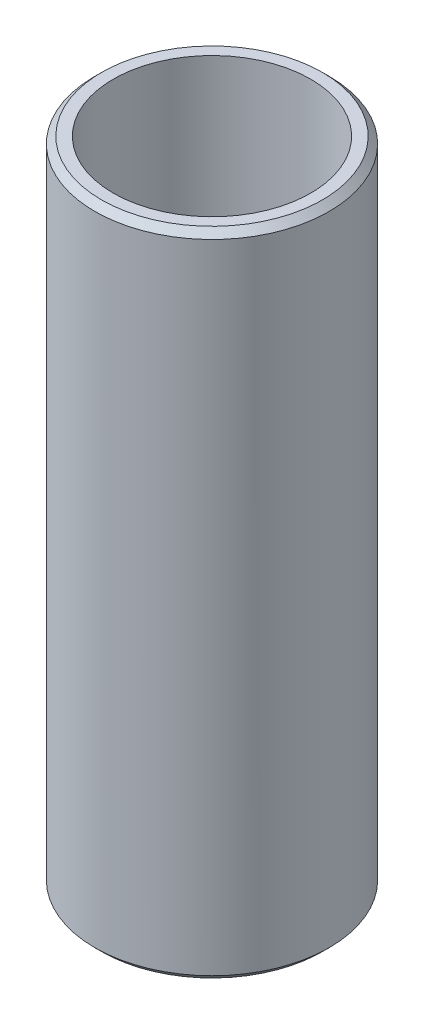
from build123d import *

# Parameters (mm, degrees)
SKETCH1_R           = 57.5
BOSS_EXTRUDE1_DEPTH = 319.575175079
SKETCH2_R           = 48.480495904
CUT_EXTRUDE1_DEPTH  = 330.758688326
CHAMFER1_SIZE       = 3.281501443


with BuildPart() as part:
    # Sketch1 → Boss-Extrude1 (new body)
    with BuildSketch(Plane(origin=(0, 0, 0), x_dir=(1, 0, 0), z_dir=(0, 1, 0))):
        Circle(SKETCH1_R)
    extrude(amount=BOSS_EXTRUDE1_DEPTH)

    # Sketch2 → Cut-Extrude1 (cut, through all)
    with BuildSketch(Plane(origin=(0, 0, 0), x_dir=(1, 0, 0), z_dir=(0, 1, 0))):
        Circle(SKETCH2_R)
    extrude(amount=CUT_EXTRUDE1_DEPTH, mode=Mode.SUBTRACT)

    # Chamfer1
    chamfer1_edges = [part.edges().sort_by_distance(p)[0] for p in [
        (-57.5, 319.575175079, 0),
        (-57.5, 0, 0),
    ]]
    chamfer(chamfer1_edges, length=CHAMFER1_SIZE)


solid = part.part
